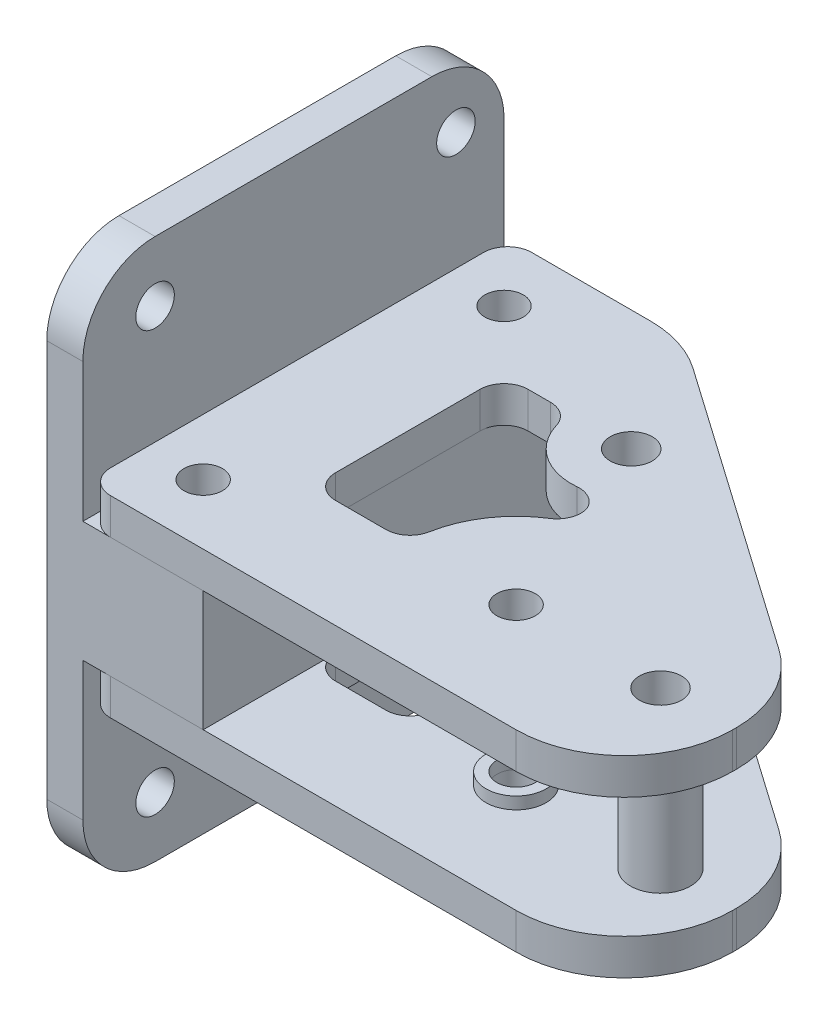
from build123d import *

# Parameters (mm, degrees)
SKETCH_1_R          = 1.6
EXTRUDE_1_DEPTH     = 3
SKETCH_2_W          = 35
SKETCH_2_H          = 10
EXTRUDE_2_DEPTH     = 10
CUT_EXTRUDE_2_REACH = 39.716
SKETCH_4_R          = 1.6
SKETCH_6_R          = 1.6
EXTRUDE_3_DEPTH     = 3
SKETCH_7_R          = 1.6
CUT_EXTRUDE_3_DEPTH = 3
SKETCH_8_R          = 1.75
CUT_EXTRUDE_4_DEPTH = 3
SKETCH_11_W         = 0.3
SKETCH_11_H         = 35
CUT_EXTRUDE_6_DEPTH = 3
FILLET_2_R          = 9
FILLET_4_R          = 2
CUT_EXTRUDE_9_DEPTH = 3
FILLET_5_R          = 2
SKETCH_9_R          = 2.5
SKETCH_9_R_2        = 1.75
EXTRUDE_4_DEPTH     = 10
SKETCH_13_R         = 2.5
SKETCH_13_R_2       = 1.6
EXTRUDE_5_DEPTH     = 1
SKETCH_14_R         = 2.5
SKETCH_14_R_2       = 1.6
EXTRUDE_6_DEPTH     = 1


with BuildPart() as part:
    # 草图1 → 凸台-拉伸1 (new body)
    with BuildSketch(Plane(origin=(-18, 0, 0), x_dir=(0, 0, -1), z_dir=(1, 0, 0))):
        with BuildLine():
            Line((-12.5, -18.5), (10.5, -18.5))
            ThreePointArc((10.5, -18.5), (14.742640687, -16.742640687), (16.5, -12.5))
            Line((16.5, -12.5), (16.5, 20.5))
            ThreePointArc((16.5, 20.5), (14.742640687, 24.742640687), (10.5, 26.5))
            Line((10.5, 26.5), (-12.5, 26.5))
            ThreePointArc((-12.5, 26.5), (-16.742640687, 24.742640687), (-18.5, 20.5))
            Line((-18.5, 20.5), (-18.5, -12.5))
            ThreePointArc((-18.5, -12.5), (-16.742640687, -16.742640687), (-12.5, -18.5))
        make_face()
        with Locations(Location((-12.5, -13.5, 0), (0, 0, 90))):
            Circle(SKETCH_1_R, mode=Mode.SUBTRACT)
        with Locations(Location((12.5, -13.5, 0), (0, 0, 90))):
            Circle(SKETCH_1_R, mode=Mode.SUBTRACT)
        with Locations(Location((12.5, 21.5, 0), (0, 0, 90))):
            Circle(SKETCH_1_R, mode=Mode.SUBTRACT)
        with Locations(Location((-12.5, 21.5, 0), (0, 0, 90))):
            Circle(SKETCH_1_R, mode=Mode.SUBTRACT)
    extrude(amount=EXTRUDE_1_DEPTH)

    # 草图2 → 凸台-拉伸2 (add)
    with BuildSketch(Plane(origin=(-15, 0, 0), x_dir=(0, 0, -1), z_dir=(1, 0, 0))):
        with Locations((-1, 4)):
            Rectangle(SKETCH_2_W, SKETCH_2_H)
    extrude(amount=EXTRUDE_2_DEPTH)

    # 草图4 → 切除-拉伸2 (cut, up to next)
    with BuildSketch(Plane.XZ.offset(1), mode=Mode.PRIVATE) as cut_extrude_2_sk1:
        with Locations((-10, 13.5)):
            Circle(SKETCH_4_R)
    cut_extrude_2_tool1 = extrude(cut_extrude_2_sk1.sketch, amount=-CUT_EXTRUDE_2_REACH, mode=Mode.PRIVATE) & part.part
    # 草图4 → 切除-拉伸2 (cut, up to next)
    with BuildSketch(Plane.XZ.offset(1), mode=Mode.PRIVATE) as cut_extrude_2_sk2:
        with Locations((-10, -11.5)):
            Circle(SKETCH_4_R)
    cut_extrude_2_tool2 = extrude(cut_extrude_2_sk2.sketch, amount=-CUT_EXTRUDE_2_REACH, mode=Mode.PRIVATE) & part.part
    add(cut_extrude_2_tool1.solids().sort_by_distance((-10, -1, 13.5))[0], mode=Mode.SUBTRACT)
    add(cut_extrude_2_tool2.solids().sort_by_distance((-10, -1, -11.5))[0], mode=Mode.SUBTRACT)


with BuildPart() as body_2:
    # 草图6 → 凸台-拉伸3 (new body)
    with BuildSketch(Plane.XZ.offset(1)):
        Polygon((-15, 18.5), (30, 18.5), (30, 4.5), (0, -16.5), (-15, -16.5), align=None)
        with Locations((-10, -11.5)):
            Circle(SKETCH_6_R, mode=Mode.SUBTRACT)
        with Locations((-10, 13.5)):
            Circle(SKETCH_6_R, mode=Mode.SUBTRACT)
    extrude(amount=EXTRUDE_3_DEPTH)

    # 草图7 → 切除-拉伸3 (cut)
    with BuildSketch(Plane.XZ.offset(4)):
        with Locations((12, 9.5)):
            Circle(SKETCH_7_R)
    extrude(amount=-CUT_EXTRUDE_3_DEPTH, mode=Mode.SUBTRACT)

    # 草图8 → 切除-拉伸4 (cut)
    with BuildSketch(Plane.XZ.offset(4)):
        with Locations((24, 9.5)):
            Circle(SKETCH_8_R)
        with Locations((5.566745989, -6.5)):
            Circle(SKETCH_8_R)
    extrude(amount=-CUT_EXTRUDE_4_DEPTH, mode=Mode.SUBTRACT)

    # 草图11 → 切除-拉伸6 (cut)
    with BuildSketch(Plane.XZ.offset(4)):
        with Locations((-14.85, 1)):
            Rectangle(SKETCH_11_W, SKETCH_11_H)
    extrude(amount=-CUT_EXTRUDE_6_DEPTH, mode=Mode.SUBTRACT)

    # 圆角2
    fillet_2_edges = [body_2.edges().sort_by_distance(p)[0] for p in [
        (30, -2.5, 18.5),
        (30, -2.5, 4.5),
        (0, -2.5, -16.5),
    ]]
    fillet(fillet_2_edges, radius=FILLET_2_R)

    # 圆角4
    fillet_4_edges = [body_2.edges().sort_by_distance(p)[0] for p in [
        (-14.7, -2.5, 18.5),
        (-14.7, -2.5, -16.5),
    ]]
    fillet(fillet_4_edges, radius=FILLET_4_R)

    # 草图12 → 切除-拉伸9 (cut)
    with BuildSketch(Plane(origin=(0, -1, 0), x_dir=(1, 0, 0), z_dir=(0, 1, 0))):
        with BuildLine():
            ThreePointArc((7.432008197, 1.860948708), (2.767309531, 2.357156107), (0.566745989, 6.5))
            Line((0.566745989, 6.5), (-5, 6.5))
            Line((-5, 6.5), (-5, -9.5))
            Line((-5, -9.5), (-0.844316184, -9.5))
            Line((-0.844316184, -9.5), (3, -9.5))
            ThreePointArc((3, -9.5), (4.542880993, -4.461014377), (8.642528025, -1.149707674))
            Line((8.642528025, -1.149707674), (7.432008197, 1.860948708))
        make_face()
    extrude(amount=-CUT_EXTRUDE_9_DEPTH, mode=Mode.SUBTRACT)

    # 圆角5
    # the kernel refuses this fillet: 2 mm, written as the material it adds along each edge
    with BuildSketch(Plane(origin=(3, -1, 9.5), x_dir=(-1, 0, 0), z_dir=(0, -1, 0))) as fillet_5_piece_1:
        with BuildLine():
            CenterArc((1.816653826, 2), FILLET_5_R, 190.475681696, 79.524318304)
            ThreePointArc((-0.150010506, 1.636363636), (-0.03758109, 0.821612607), (0, 0))
            Line((0, 0), (1.816653826, 0))
        make_face()
    extrude(amount=3)
    with BuildSketch(Plane(origin=(-5, -1, 9.5), x_dir=(0, 0, -1), z_dir=(0, -1, 0)), Plane(origin=(-5, -1, -6.5), x_dir=(1, 0, 0), z_dir=(0, -1, 0))) as fillet_5_piece_2:
        with BuildLine():
            CenterArc((FILLET_5_R, FILLET_5_R), FILLET_5_R, 180, 90)
            Line((0, FILLET_5_R), (0, 0))
            Line((0, 0), (FILLET_5_R, 0))
        make_face()
    extrude(amount=3)
    with BuildSketch(Plane(origin=(0.566745989, -1, -6.5), x_dir=(0.1443695821495735, 0, 0.9895238368781005), z_dir=(0, -1, 0))) as fillet_5_piece_3:
        with BuildLine():
            CenterArc((1.732434986, 1.979047674), FILLET_5_R, 188.300774799, 73.398450401)
            Line((-0.246612688, 1.690308509), (0, 0))
            ThreePointArc((0, 0), (0.721847911, 0.052380816), (1.443695821, 0))
        make_face()
    extrude(amount=3)
    with BuildSketch(Plane(origin=(7.432008197, -1, -1.860948708), x_dir=(-0.9719477919968166, 0, 0.23519670412765736), z_dir=(0, -1, 0))) as fillet_5_piece_4:
        with BuildLine():
            CenterArc((1.732434986, -1.979047674), FILLET_5_R, 98.3007748, 73.398450401)
            Line((-0.246612688, -1.690308509), (0, 0))
            ThreePointArc((0, 0), (0.721847911, -0.052380816), (1.443695821, 0))
        make_face()
    extrude(amount=3)
    with BuildSketch(Plane(origin=(8.642528025, -1, 1.149707674), x_dir=(-0.8898799574196085, 0, 0.45619476255528824), z_dir=(0, -1, 0))) as fillet_5_piece_5:
        with BuildLine():
            CenterArc((1.825805793, 1.991648647), FILLET_5_R, 185.237840848, 79.524318304)
            Line((-0.165842854, 1.809068067), (0, 0))
            ThreePointArc((0, 0), (0.821612607, 0.03758109), (1.643225213, 0))
        make_face()
    extrude(amount=3)


with BuildPart() as body_3:
    # 镜向1: mirrored copy
    add(body_2.part.mirror(Plane(origin=(0, 4, 0), x_dir=(0, 0, 1), z_dir=(0, -1, 0))))


with BuildPart() as body_4:
    # 草图9 → 凸台-拉伸4 (new body)
    with BuildSketch(Plane(origin=(0, -1, 0), x_dir=(1, 0, 0), z_dir=(0, 1, 0))):
        with Locations(Location((24, -9.5, 0), (0, 0, 180))):
            Circle(SKETCH_9_R)
        with Locations(Location((24, -9.5, 0), (0, 0, 180))):
            Circle(SKETCH_9_R_2, mode=Mode.SUBTRACT)
    extrude(amount=EXTRUDE_4_DEPTH)


with BuildPart() as body_5:
    # 草图13 → 凸台-拉伸5 (new body)
    with BuildSketch(Plane(origin=(0, -1, 0), x_dir=(1, 0, 0), z_dir=(0, 1, 0))):
        with Locations(Location((12, -9.5, 0), (0, 0, 180))):
            Circle(SKETCH_13_R)
        with Locations(Location((12, -9.5, 0), (0, 0, 180))):
            Circle(SKETCH_13_R_2, mode=Mode.SUBTRACT)
    extrude(amount=EXTRUDE_5_DEPTH)


with BuildPart() as body_6:
    # 草图14 → 凸台-拉伸6 (new body)
    with BuildSketch(Plane.XZ.offset(-9)):
        with Locations((12, 9.5)):
            Circle(SKETCH_14_R)
        with Locations((12, 9.5)):
            Circle(SKETCH_14_R_2, mode=Mode.SUBTRACT)
    extrude(amount=EXTRUDE_6_DEPTH)


solid = Compound([part.part, body_2.part, body_3.part, body_4.part, body_5.part, body_6.part])
